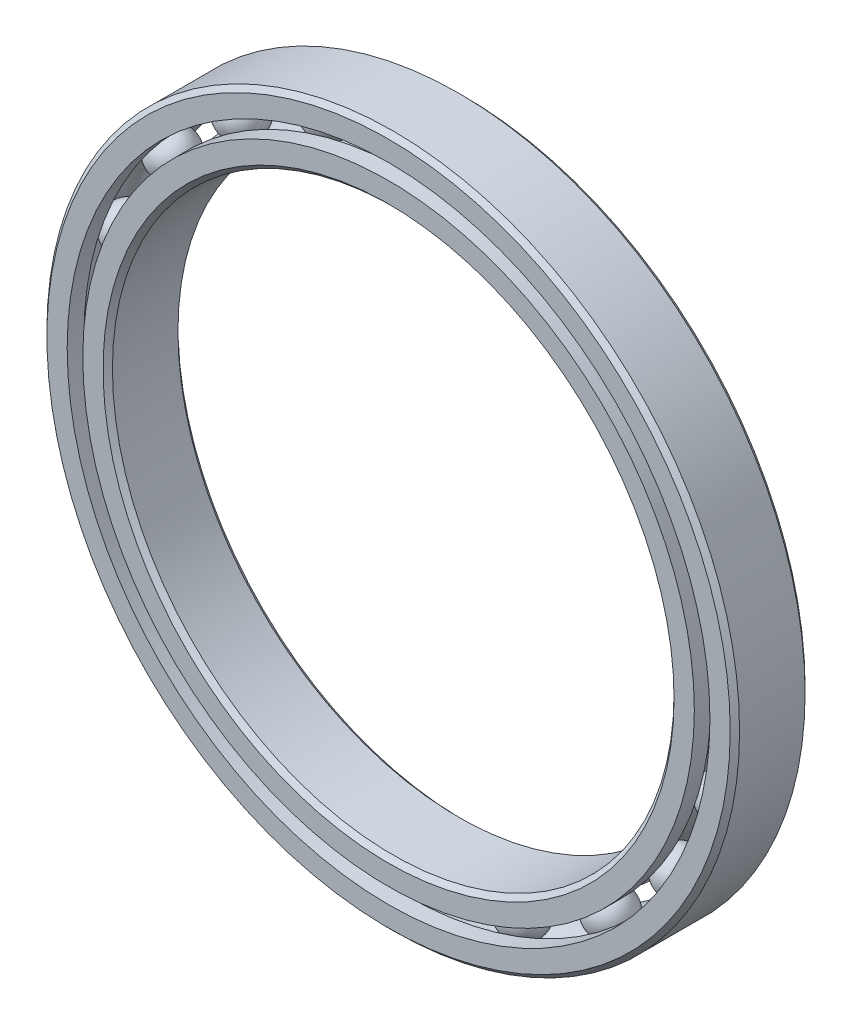
from build123d import *

# Parameters (mm, degrees)
CIRPATTERN1_COUNT = 20


with BuildPart() as part:
    # Sketch1 → Revolve1 (revolve)
    with BuildSketch(Plane(origin=(0, 0, 0), x_dir=(0, 0, -1), z_dir=(1, 0, 0))):
        with BuildLine():
            Line((1.75, 18.5), (-1.75, 18.5))
            Line((-1.75, 18.5), (-2, 18.25))
            Line((-2, 18.25), (-2, 17.166800235))
            Line((-2, 17.166800235), (-1.111111111, 17.166800235))
            ThreePointArc((-1.111111111, 17.166800235), (0, 17.936714092), (1.111111111, 17.166800235))
            Line((1.111111111, 17.166800235), (2, 17.166800235))
            Line((2, 17.166800235), (2, 18.25))
            Line((2, 18.25), (1.75, 18.5))
        make_face()
    revolve(axis=Axis((0, 0, 2), (0, 0, -1)))


with BuildPart() as body_2:
    # Sketch3 → Revolve3 (revolve)
    with BuildSketch(Plane(origin=(0, 0, 0), x_dir=(0, 0, -1), z_dir=(1, 0, 0))):
        with BuildLine():
            Line((-2, 16.333199765), (-1.111111111, 16.333199765))
            ThreePointArc((-1.111111111, 16.333199765), (0, 15.563285908), (1.111111111, 16.333199765))
            Line((1.111111111, 16.333199765), (2, 16.333199765))
            Line((2, 16.333199765), (2, 15.25))
            Line((2, 15.25), (1.75, 15))
            Line((1.75, 15), (-1.75, 15))
            Line((-1.75, 15), (-2, 15.25))
            Line((-2, 15.25), (-2, 16.333199765))
        make_face()
    revolve(axis=Axis((0, 0, 2), (0, 0, -1)))


with BuildPart() as body_3:
    # Sketch4 → Revolve4 (revolve)
    with BuildSketch(Plane(origin=(0, 0, 0), x_dir=(0, 0, -1), z_dir=(1, 0, 0))):
        with BuildLine():
            Line((-1.186714092, 16.75), (1.186714092, 16.75))
            ThreePointArc((1.186714092, 16.75), (0, 17.936714092), (-1.186714092, 16.75))
        make_face()
    revolve(axis=Axis((0, 16.75, 1.186714092), (0, 0, -1)))


with BuildPart() as cirpattern1_1:
    # CirPattern1: pattern copy
    add(body_3.part.rotate(Axis((0, 0, -2), (0, 0, 1)), 1 * 360 / CIRPATTERN1_COUNT))


with BuildPart() as cirpattern1_2:
    # CirPattern1: pattern copy
    add(body_3.part.rotate(Axis((0, 0, -2), (0, 0, 1)), 2 * 360 / CIRPATTERN1_COUNT))


with BuildPart() as cirpattern1_3:
    # CirPattern1: pattern copy
    add(body_3.part.rotate(Axis((0, 0, -2), (0, 0, 1)), 3 * 360 / CIRPATTERN1_COUNT))


with BuildPart() as cirpattern1_4:
    # CirPattern1: pattern copy
    add(body_3.part.rotate(Axis((0, 0, -2), (0, 0, 1)), 4 * 360 / CIRPATTERN1_COUNT))


with BuildPart() as cirpattern1_5:
    # CirPattern1: pattern copy
    add(body_3.part.rotate(Axis((0, 0, -2), (0, 0, 1)), 5 * 360 / CIRPATTERN1_COUNT))


with BuildPart() as cirpattern1_6:
    # CirPattern1: pattern copy
    add(body_3.part.rotate(Axis((0, 0, -2), (0, 0, 1)), 6 * 360 / CIRPATTERN1_COUNT))


with BuildPart() as cirpattern1_7:
    # CirPattern1: pattern copy
    add(body_3.part.rotate(Axis((0, 0, -2), (0, 0, 1)), 7 * 360 / CIRPATTERN1_COUNT))


with BuildPart() as cirpattern1_8:
    # CirPattern1: pattern copy
    add(body_3.part.rotate(Axis((0, 0, -2), (0, 0, 1)), 8 * 360 / CIRPATTERN1_COUNT))


with BuildPart() as cirpattern1_9:
    # CirPattern1: pattern copy
    add(body_3.part.rotate(Axis((0, 0, -2), (0, 0, 1)), 9 * 360 / CIRPATTERN1_COUNT))


with BuildPart() as cirpattern1_10:
    # CirPattern1: pattern copy
    add(body_3.part.rotate(Axis((0, 0, -2), (0, 0, 1)), 10 * 360 / CIRPATTERN1_COUNT))


with BuildPart() as cirpattern1_11:
    # CirPattern1: pattern copy
    add(body_3.part.rotate(Axis((0, 0, -2), (0, 0, 1)), 11 * 360 / CIRPATTERN1_COUNT))


with BuildPart() as cirpattern1_12:
    # CirPattern1: pattern copy
    add(body_3.part.rotate(Axis((0, 0, -2), (0, 0, 1)), 12 * 360 / CIRPATTERN1_COUNT))


with BuildPart() as cirpattern1_13:
    # CirPattern1: pattern copy
    add(body_3.part.rotate(Axis((0, 0, -2), (0, 0, 1)), 13 * 360 / CIRPATTERN1_COUNT))


with BuildPart() as cirpattern1_14:
    # CirPattern1: pattern copy
    add(body_3.part.rotate(Axis((0, 0, -2), (0, 0, 1)), 14 * 360 / CIRPATTERN1_COUNT))


with BuildPart() as cirpattern1_15:
    # CirPattern1: pattern copy
    add(body_3.part.rotate(Axis((0, 0, -2), (0, 0, 1)), 15 * 360 / CIRPATTERN1_COUNT))


with BuildPart() as cirpattern1_16:
    # CirPattern1: pattern copy
    add(body_3.part.rotate(Axis((0, 0, -2), (0, 0, 1)), 16 * 360 / CIRPATTERN1_COUNT))


with BuildPart() as cirpattern1_17:
    # CirPattern1: pattern copy
    add(body_3.part.rotate(Axis((0, 0, -2), (0, 0, 1)), 17 * 360 / CIRPATTERN1_COUNT))


with BuildPart() as cirpattern1_18:
    # CirPattern1: pattern copy
    add(body_3.part.rotate(Axis((0, 0, -2), (0, 0, 1)), 18 * 360 / CIRPATTERN1_COUNT))


with BuildPart() as cirpattern1_19:
    # CirPattern1: pattern copy
    add(body_3.part.rotate(Axis((0, 0, -2), (0, 0, 1)), 19 * 360 / CIRPATTERN1_COUNT))


solid = Compound([part.part, body_2.part, body_3.part, cirpattern1_1.part, cirpattern1_2.part, cirpattern1_3.part, cirpattern1_4.part, cirpattern1_5.part, cirpattern1_6.part, cirpattern1_7.part, cirpattern1_8.part, cirpattern1_9.part, cirpattern1_10.part, cirpattern1_11.part, cirpattern1_12.part, cirpattern1_13.part, cirpattern1_14.part, cirpattern1_15.part, cirpattern1_16.part, cirpattern1_17.part, cirpattern1_18.part, cirpattern1_19.part])
